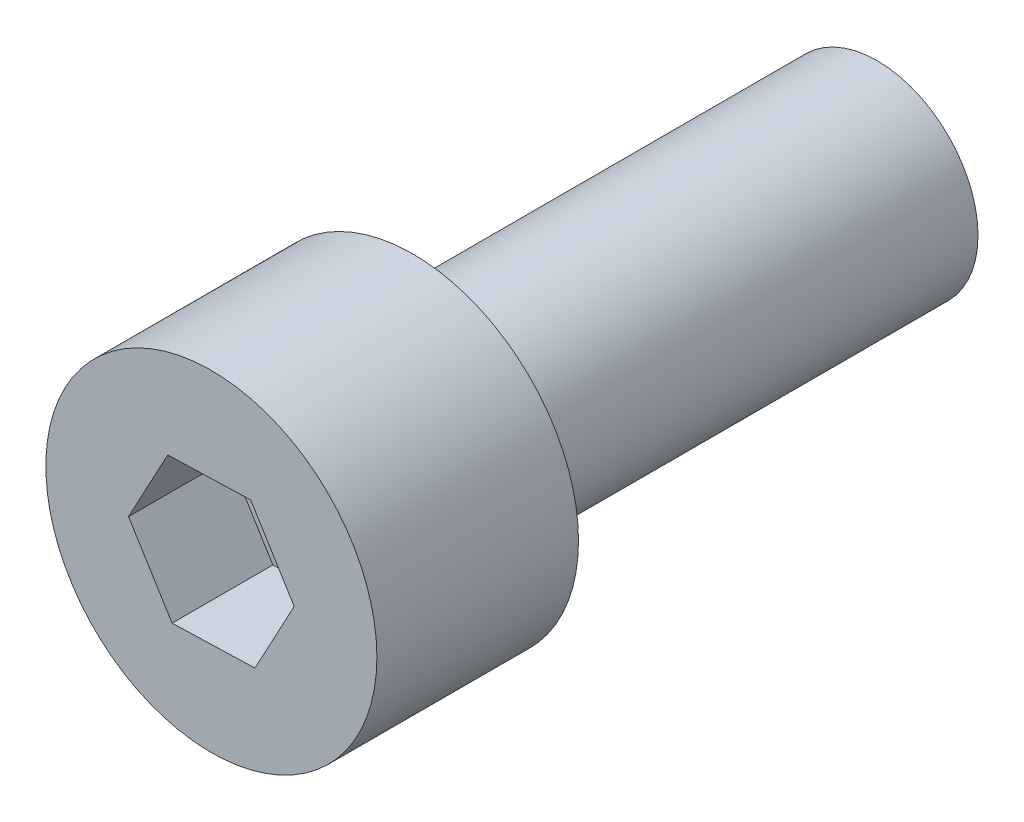
from build123d import *

# Parameters (mm, degrees)
SKETCH1_R           = 2.413
BOSS_EXTRUDE1_DEPTH = 11.1125
SKETCH2_R           = 3.9624
BOSS_EXTRUDE2_DEPTH = 4.826
CUT_EXTRUDE1_DEPTH  = 2.413


with BuildPart() as part:
    # Sketch1 → Boss-Extrude1 (new body)
    with BuildSketch(Plane.XY):
        Circle(SKETCH1_R)
    extrude(amount=BOSS_EXTRUDE1_DEPTH)

    # Sketch2 → Boss-Extrude2 (add)
    with BuildSketch(Plane.XY.offset(11.1125)):
        Circle(SKETCH2_R)
    extrude(amount=BOSS_EXTRUDE2_DEPTH)

    # Sketch3 → Cut-Extrude1 (cut)
    with BuildSketch(Plane.XY.offset(15.9385)):
        Polygon((-1.043447125, 1.687886915), (-1.98347651, -0.059708261), (-0.940029384, -1.747595175), (1.043447125, -1.687886915), (1.98347651, 0.059708261), (0.940029384, 1.747595175), align=None)
    extrude(amount=-CUT_EXTRUDE1_DEPTH, mode=Mode.SUBTRACT)


solid = part.part
